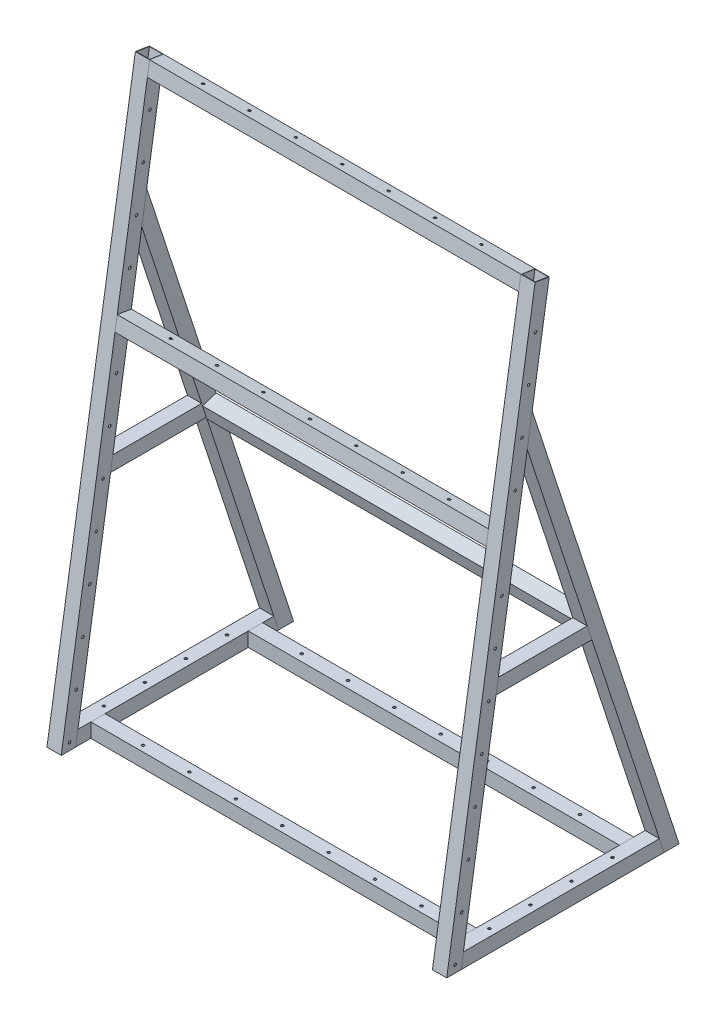
from build123d import *

# Parameters (mm, degrees)
STRUCTURAL_START                = -1397
STRUCTURAL_MEMBER1_DEPTH        = 50.8
STRUCTURAL_MEMBER1_2_DEPTH      = 1.651
STRUCTURAL_START_2              = -1347.851
STRUCTURAL_MEMBER1_3_DEPTH      = 1.651
STRUCTURAL_START_3              = 1904.927734954
STRUCTURAL_MEMBER1_4_OUTLINE_W  = 1320.8
STRUCTURAL_MEMBER1_4_OUTLINE_H  = 1.651
STRUCTURAL_MEMBER1_4_DEPTH      = 50.8
STRUCTURAL_MEMBER1_5_OUTLINE_W  = 1320.8
STRUCTURAL_MEMBER1_5_OUTLINE_H  = 47.498
STRUCTURAL_MEMBER1_5_DEPTH      = 1.651
STRUCTURAL_START_4              = 1954.076734954
STRUCTURAL_MEMBER1_6_OUTLINE_W  = 1320.8
STRUCTURAL_MEMBER1_6_OUTLINE_H  = 47.498
STRUCTURAL_MEMBER1_6_DEPTH      = 1.651
STRUCTURAL_MEMBER1_7_DEPTH      = 50.8
STRUCTURAL_MEMBER1_8_DEPTH      = 1.651
STRUCTURAL_MEMBER1_9_DEPTH      = 1.651
STRUCTURAL_START_5              = -25.4
STRUCTURAL_MEMBER1_10_DEPTH     = 50.8
STRUCTURAL_MEMBER1_11_DEPTH     = 1.651
STRUCTURAL_START_6              = 23.749
STRUCTURAL_MEMBER1_12_DEPTH     = 1.651
STRUCTURAL_MEMBER1_13_DEPTH     = 50.8
STRUCTURAL_MEMBER1_14_DEPTH     = 1.651
STRUCTURAL_MEMBER1_15_DEPTH     = 1.651
STRUCTURAL_MEMBER1_16_DEPTH     = 50.8
STRUCTURAL_MEMBER1_17_DEPTH     = 1.651
STRUCTURAL_MEMBER1_18_DEPTH     = 1.651
STRUCTURAL_START_7              = 497.465561526
STRUCTURAL_MEMBER1_19_OUTLINE_W = 1320.8
STRUCTURAL_MEMBER1_19_OUTLINE_H = 1.651
STRUCTURAL_MEMBER1_19_DEPTH     = 50.8
STRUCTURAL_MEMBER1_20_OUTLINE_W = 1320.8
STRUCTURAL_MEMBER1_20_OUTLINE_H = 47.498
STRUCTURAL_MEMBER1_20_DEPTH     = 1.651
STRUCTURAL_START_8              = 546.614561526
STRUCTURAL_MEMBER1_21_OUTLINE_W = 1320.8
STRUCTURAL_MEMBER1_21_OUTLINE_H = 47.498
STRUCTURAL_MEMBER1_21_DEPTH     = 1.651
STRUCTURAL_MEMBER1_22_DEPTH     = 50.8
STRUCTURAL_MEMBER1_23_DEPTH     = 1.651
STRUCTURAL_MEMBER1_24_DEPTH     = 1.651
STRUCTURAL_MEMBER1_25_DEPTH     = 50.8
STRUCTURAL_MEMBER1_26_DEPTH     = 1.651
STRUCTURAL_MEMBER1_27_DEPTH     = 1.651
STRUCTURAL_MEMBER1_28_DEPTH     = 50.8
STRUCTURAL_MEMBER1_29_DEPTH     = 1.651
STRUCTURAL_MEMBER1_30_DEPTH     = 1.651
STRUCTURAL_START_9              = 1168.327734954
STRUCTURAL_MEMBER1_31_OUTLINE_W = 1320.8
STRUCTURAL_MEMBER1_31_OUTLINE_H = 1.651
STRUCTURAL_MEMBER1_31_DEPTH     = 50.8
STRUCTURAL_MEMBER1_32_OUTLINE_W = 1320.8
STRUCTURAL_MEMBER1_32_OUTLINE_H = 47.498
STRUCTURAL_MEMBER1_32_DEPTH     = 1.651
STRUCTURAL_START_10             = 1217.476734954
STRUCTURAL_MEMBER1_33_OUTLINE_W = 1320.8
STRUCTURAL_MEMBER1_33_OUTLINE_H = 47.498
STRUCTURAL_MEMBER1_33_DEPTH     = 1.651
STRUCTURAL_START_11             = -773.986645849
STRUCTURAL_MEMBER1_34_OUTLINE_W = 1320.8
STRUCTURAL_MEMBER1_34_OUTLINE_H = 1.651
STRUCTURAL_MEMBER1_34_DEPTH     = 50.8
STRUCTURAL_MEMBER1_35_OUTLINE_W = 1320.8
STRUCTURAL_MEMBER1_35_OUTLINE_H = 47.498
STRUCTURAL_MEMBER1_35_DEPTH     = 1.651
STRUCTURAL_START_12             = -724.837645849
STRUCTURAL_MEMBER1_36_OUTLINE_W = 1320.8
STRUCTURAL_MEMBER1_36_OUTLINE_H = 47.498
STRUCTURAL_MEMBER1_36_DEPTH     = 1.651
STRUCTURAL_START_13             = -213.662645849
STRUCTURAL_MEMBER1_37_OUTLINE_W = 1320.8
STRUCTURAL_MEMBER1_37_OUTLINE_H = 1.651
STRUCTURAL_MEMBER1_37_DEPTH     = 50.8
STRUCTURAL_MEMBER1_38_OUTLINE_W = 1320.8
STRUCTURAL_MEMBER1_38_OUTLINE_H = 47.498
STRUCTURAL_MEMBER1_38_DEPTH     = 1.651
STRUCTURAL_START_14             = -164.513645849
STRUCTURAL_MEMBER1_39_OUTLINE_W = 1320.8
STRUCTURAL_MEMBER1_39_OUTLINE_H = 47.498
STRUCTURAL_MEMBER1_39_DEPTH     = 1.651
SKETCH12_R                      = 4.7625
CUT_EXTRUDE1_DEPTH              = 2546.506811911
SKETCH13_R                      = 4.7625
CUT_EXTRUDE2_DEPTH              = 2549.786831157
SKETCH15_R                      = 4.7625
CUT_EXTRUDE3_DEPTH              = 2505.608071401


# Read off the part's stored shape, not the designer's step: Structural Member1
with BuildPart() as part:
    # Structural Member1 outline → Structural Member1 (new body)
    with BuildSketch(Plane.YZ.offset(STRUCTURAL_START)):
        Polygon((1921.145092162, -372.265324136), (-65.036483637, -57.68506687), (-65.036483637, -59.356646793), (1920.88681886, -373.895997586), align=None)
        Polygon((1913.45649464, -420.809218388), (-65.036483637, -107.446715338), (-65.036483637, -109.11829526), (1913.198221338, -422.439891838), align=None)
    extrude(amount=STRUCTURAL_MEMBER1_DEPTH)

    # Structural Member1 2 outline → Structural Member1 2 (add)
    with BuildSketch(Plane.YZ.offset(STRUCTURAL_START)):
        Polygon((1920.88681886, -373.895997586), (-65.036483637, -59.356646793), (-65.036483637, -107.446715338), (1913.45649464, -420.809218388), align=None)
    extrude(amount=STRUCTURAL_MEMBER1_2_DEPTH)

    # Structural Member1 3 outline → Structural Member1 3 (add)
    with BuildSketch(Plane.YZ.offset(STRUCTURAL_START_2)):
        Polygon((1920.88681886, -373.895997586), (-65.036483637, -59.356646793), (-65.036483637, -107.446715338), (1913.45649464, -420.809218388), align=None)
    extrude(amount=STRUCTURAL_MEMBER1_3_DEPTH)


with BuildPart() as body_2:
    # Structural Member1 4 outline → Structural Member1 4 (new body)
    with BuildSketch(Plane(origin=(0, 0, 0), x_dir=(1, 0, 0), z_dir=(0, 0.9876883405951382, -0.15643446504022804)).offset(STRUCTURAL_START_3)):
        with Locations((-685.8, 67.9743155)):
            Rectangle(STRUCTURAL_MEMBER1_4_OUTLINE_W, STRUCTURAL_MEMBER1_4_OUTLINE_H)
        with Locations((-685.8, 117.1233155)):
            Rectangle(STRUCTURAL_MEMBER1_4_OUTLINE_W, STRUCTURAL_MEMBER1_4_OUTLINE_H)
    extrude(amount=STRUCTURAL_MEMBER1_4_DEPTH)

    # Structural Member1 5 outline → Structural Member1 5 (add)
    with BuildSketch(Plane(origin=(0, 0, 0), x_dir=(1, 0, 0), z_dir=(0, 0.9876883405951382, -0.15643446504022804)).offset(STRUCTURAL_START_3)):
        with Locations((-685.8, 92.5488155)):
            Rectangle(STRUCTURAL_MEMBER1_5_OUTLINE_W, STRUCTURAL_MEMBER1_5_OUTLINE_H)
    extrude(amount=STRUCTURAL_MEMBER1_5_DEPTH)

    # Structural Member1 6 outline → Structural Member1 6 (add)
    with BuildSketch(Plane(origin=(0, 0, 0), x_dir=(1, 0, 0), z_dir=(0, 0.9876883405951382, -0.15643446504022804)).offset(STRUCTURAL_START_4)):
        with Locations((-685.8, 92.5488155)):
            Rectangle(STRUCTURAL_MEMBER1_6_OUTLINE_W, STRUCTURAL_MEMBER1_6_OUTLINE_H)
    extrude(amount=STRUCTURAL_MEMBER1_6_DEPTH)


with BuildPart() as body_3:
    # Structural Member1 7 outline → Structural Member1 7 (new body)
    with BuildSketch(Plane.YZ.offset(STRUCTURAL_START)):
        Polygon((-65.036483637, -831.017408501), (-63.385483637, -830.476542849), (-63.385483637, -109.379787971), (-65.036483637, -109.11829526), align=None)
        Polygon((-15.887483637, -116.902732118), (-15.887483637, -814.916254094), (-14.236483637, -814.375388442), (-14.236483637, -117.164224829), align=None)
    extrude(amount=STRUCTURAL_MEMBER1_7_DEPTH)

    # Structural Member1 8 outline → Structural Member1 8 (add)
    with BuildSketch(Plane.YZ.offset(STRUCTURAL_START)):
        Polygon((-63.385483637, -109.379787971), (-63.385483637, -830.476542849), (-15.887483637, -814.916254094), (-15.887483637, -116.902732118), align=None)
    extrude(amount=STRUCTURAL_MEMBER1_8_DEPTH)

    # Structural Member1 9 outline → Structural Member1 9 (add)
    with BuildSketch(Plane.YZ.offset(STRUCTURAL_START_2)):
        Polygon((-63.385483637, -109.379787971), (-63.385483637, -830.476542849), (-15.887483637, -814.916254094), (-15.887483637, -116.902732118), align=None)
    extrude(amount=STRUCTURAL_MEMBER1_9_DEPTH)


with BuildPart() as body_4:
    # Structural Member1 10 outline → Structural Member1 10 (new body)
    with BuildSketch(Plane.YZ.offset(STRUCTURAL_START_5)):
        Polygon((1921.145092162, -372.265324136), (-65.036483637, -57.68506687), (-65.036483637, -59.356646793), (1920.88681886, -373.895997586), align=None)
        Polygon((1913.45649464, -420.809218388), (-65.036483637, -107.446715338), (-65.036483637, -109.11829526), (1913.198221338, -422.439891838), align=None)
    extrude(amount=STRUCTURAL_MEMBER1_10_DEPTH)

    # Structural Member1 11 outline → Structural Member1 11 (add)
    with BuildSketch(Plane.YZ.offset(STRUCTURAL_START_5)):
        Polygon((1920.88681886, -373.895997586), (-65.036483637, -59.356646793), (-65.036483637, -107.446715338), (1913.45649464, -420.809218388), align=None)
    extrude(amount=STRUCTURAL_MEMBER1_11_DEPTH)

    # Structural Member1 12 outline → Structural Member1 12 (add)
    with BuildSketch(Plane.YZ.offset(STRUCTURAL_START_6)):
        Polygon((1920.88681886, -373.895997586), (-65.036483637, -59.356646793), (-65.036483637, -107.446715338), (1913.45649464, -420.809218388), align=None)
    extrude(amount=STRUCTURAL_MEMBER1_12_DEPTH)


with BuildPart() as body_5:
    # Structural Member1 13 outline → Structural Member1 13 (new body)
    with BuildSketch(Plane.YZ.offset(STRUCTURAL_START_5)):
        Polygon((-65.036483637, -831.017408501), (-63.385483637, -830.476542849), (-63.385483637, -109.379787971), (-65.036483637, -109.11829526), align=None)
        Polygon((-15.887483637, -116.902732118), (-15.887483637, -814.916254094), (-14.236483637, -814.375388442), (-14.236483637, -117.164224829), align=None)
    extrude(amount=STRUCTURAL_MEMBER1_13_DEPTH)

    # Structural Member1 14 outline → Structural Member1 14 (add)
    with BuildSketch(Plane.YZ.offset(STRUCTURAL_START_5)):
        Polygon((-63.385483637, -109.379787971), (-63.385483637, -830.476542849), (-15.887483637, -814.916254094), (-15.887483637, -116.902732118), align=None)
    extrude(amount=STRUCTURAL_MEMBER1_14_DEPTH)

    # Structural Member1 15 outline → Structural Member1 15 (add)
    with BuildSketch(Plane.YZ.offset(STRUCTURAL_START_6)):
        Polygon((-63.385483637, -109.379787971), (-63.385483637, -830.476542849), (-15.887483637, -814.916254094), (-15.887483637, -116.902732118), align=None)
    extrude(amount=STRUCTURAL_MEMBER1_15_DEPTH)


with BuildPart() as body_6:
    # Structural Member1 16 outline → Structural Member1 16 (new body)
    with BuildSketch(Plane.YZ.offset(STRUCTURAL_START_5)):
        Polygon((769.741136711, -241.334081454), (768.090136711, -241.072588743), (768.090136711, -558.08611072), (769.741136711, -557.545245068), align=None)
        Polygon((720.592136711, -573.646399474), (720.592136711, -233.549644597), (718.941136711, -233.288151886), (718.941136711, -574.187265126), align=None)
    extrude(amount=STRUCTURAL_MEMBER1_16_DEPTH)

    # Structural Member1 17 outline → Structural Member1 17 (add)
    with BuildSketch(Plane.YZ.offset(STRUCTURAL_START_5)):
        Polygon((768.090136711, -558.08611072), (768.090136711, -241.072588743), (720.592136711, -233.549644597), (720.592136711, -573.646399474), align=None)
    extrude(amount=STRUCTURAL_MEMBER1_17_DEPTH)

    # Structural Member1 18 outline → Structural Member1 18 (add)
    with BuildSketch(Plane.YZ.offset(STRUCTURAL_START_6)):
        Polygon((768.090136711, -558.08611072), (768.090136711, -241.072588743), (720.592136711, -233.549644597), (720.592136711, -573.646399474), align=None)
    extrude(amount=STRUCTURAL_MEMBER1_18_DEPTH)


with BuildPart() as body_7:
    # Structural Member1 19 outline → Structural Member1 19 (new body)
    with BuildSketch(Plane(origin=(0, 0, 0), x_dir=(1, 0, 0), z_dir=(0, 0.9503054817108173, 0.31131895449903413)).offset(STRUCTURAL_START_7)):
        with Locations((-685.8, 819.447808605)):
            Rectangle(STRUCTURAL_MEMBER1_19_OUTLINE_W, STRUCTURAL_MEMBER1_19_OUTLINE_H)
        with Locations((-685.8, 770.298808605)):
            Rectangle(STRUCTURAL_MEMBER1_19_OUTLINE_W, STRUCTURAL_MEMBER1_19_OUTLINE_H)
    extrude(amount=STRUCTURAL_MEMBER1_19_DEPTH)

    # Structural Member1 20 outline → Structural Member1 20 (add)
    with BuildSketch(Plane(origin=(0, 0, 0), x_dir=(1, 0, 0), z_dir=(0, 0.9503054817108173, 0.31131895449903413)).offset(STRUCTURAL_START_7)):
        with Locations((-685.8, 794.873308605)):
            Rectangle(STRUCTURAL_MEMBER1_20_OUTLINE_W, STRUCTURAL_MEMBER1_20_OUTLINE_H)
    extrude(amount=STRUCTURAL_MEMBER1_20_DEPTH)

    # Structural Member1 21 outline → Structural Member1 21 (add)
    with BuildSketch(Plane(origin=(0, 0, 0), x_dir=(1, 0, 0), z_dir=(0, 0.9503054817108173, 0.31131895449903413)).offset(STRUCTURAL_START_8)):
        with Locations((-685.8, 794.873308605)):
            Rectangle(STRUCTURAL_MEMBER1_21_OUTLINE_W, STRUCTURAL_MEMBER1_21_OUTLINE_H)
    extrude(amount=STRUCTURAL_MEMBER1_21_DEPTH)


with BuildPart() as body_8:
    # Structural Member1 22 outline → Structural Member1 22 (new body)
    with BuildSketch(Plane.YZ.offset(STRUCTURAL_START)):
        Polygon((769.741136711, -241.334081454), (768.090136711, -241.072588743), (768.090136711, -558.08611072), (769.741136711, -557.545245068), align=None)
        Polygon((720.592136711, -573.646399474), (720.592136711, -233.549644597), (718.941136711, -233.288151886), (718.941136711, -574.187265126), align=None)
    extrude(amount=STRUCTURAL_MEMBER1_22_DEPTH)

    # Structural Member1 23 outline → Structural Member1 23 (add)
    with BuildSketch(Plane.YZ.offset(STRUCTURAL_START)):
        Polygon((768.090136711, -558.08611072), (768.090136711, -241.072588743), (720.592136711, -233.549644597), (720.592136711, -573.646399474), align=None)
    extrude(amount=STRUCTURAL_MEMBER1_23_DEPTH)

    # Structural Member1 24 outline → Structural Member1 24 (add)
    with BuildSketch(Plane.YZ.offset(STRUCTURAL_START_2)):
        Polygon((768.090136711, -558.08611072), (768.090136711, -241.072588743), (720.592136711, -233.549644597), (720.592136711, -573.646399474), align=None)
    extrude(amount=STRUCTURAL_MEMBER1_24_DEPTH)


with BuildPart() as body_9:
    # Structural Member1 25 outline → Structural Member1 25 (new body)
    with BuildSketch(Plane.YZ.offset(STRUCTURAL_START_5)):
        Polygon((1530.400378516, -361.810669745), (1526.825489788, -361.244462995), (-65.036483637, -882.736567177), (-65.036483637, -884.473903257), align=None)
        Polygon((-65.036483637, -832.75474458), (1423.978690994, -344.955130329), (1420.403802266, -344.388923579), (-65.036483637, -831.017408501), align=None)
    extrude(amount=STRUCTURAL_MEMBER1_25_DEPTH)

    # Structural Member1 26 outline → Structural Member1 26 (add)
    with BuildSketch(Plane.YZ.offset(STRUCTURAL_START_5)):
        Polygon((-65.036483637, -882.736567177), (1526.825489788, -361.244462995), (1423.978690994, -344.955130329), (-65.036483637, -832.75474458), align=None)
    extrude(amount=STRUCTURAL_MEMBER1_26_DEPTH)

    # Structural Member1 27 outline → Structural Member1 27 (add)
    with BuildSketch(Plane.YZ.offset(STRUCTURAL_START_6)):
        Polygon((-65.036483637, -882.736567177), (1526.825489788, -361.244462995), (1423.978690994, -344.955130329), (-65.036483637, -832.75474458), align=None)
    extrude(amount=STRUCTURAL_MEMBER1_27_DEPTH)


with BuildPart() as body_10:
    # Structural Member1 28 outline → Structural Member1 28 (new body)
    with BuildSketch(Plane.YZ.offset(STRUCTURAL_START)):
        Polygon((1530.400378516, -361.810669745), (1526.825489788, -361.244462995), (-65.036483637, -882.736567177), (-65.036483637, -884.473903257), align=None)
        Polygon((-65.036483637, -832.75474458), (1423.978690994, -344.955130329), (1420.403802266, -344.388923579), (-65.036483637, -831.017408501), align=None)
    extrude(amount=STRUCTURAL_MEMBER1_28_DEPTH)

    # Structural Member1 29 outline → Structural Member1 29 (add)
    with BuildSketch(Plane.YZ.offset(STRUCTURAL_START)):
        Polygon((-65.036483637, -882.736567177), (1526.825489788, -361.244462995), (1423.978690994, -344.955130329), (-65.036483637, -832.75474458), align=None)
    extrude(amount=STRUCTURAL_MEMBER1_29_DEPTH)

    # Structural Member1 30 outline → Structural Member1 30 (add)
    with BuildSketch(Plane.YZ.offset(STRUCTURAL_START_2)):
        Polygon((-65.036483637, -882.736567177), (1526.825489788, -361.244462995), (1423.978690994, -344.955130329), (-65.036483637, -832.75474458), align=None)
    extrude(amount=STRUCTURAL_MEMBER1_30_DEPTH)


with BuildPart() as body_11:
    # Structural Member1 31 outline → Structural Member1 31 (new body)
    with BuildSketch(Plane(origin=(0, 0, 0), x_dir=(1, 0, 0), z_dir=(0, 0.9876883405951382, -0.15643446504022804)).offset(STRUCTURAL_START_9)):
        with Locations((-685.8, 67.9743155)):
            Rectangle(STRUCTURAL_MEMBER1_31_OUTLINE_W, STRUCTURAL_MEMBER1_31_OUTLINE_H)
        with Locations((-685.8, 117.1233155)):
            Rectangle(STRUCTURAL_MEMBER1_31_OUTLINE_W, STRUCTURAL_MEMBER1_31_OUTLINE_H)
    extrude(amount=STRUCTURAL_MEMBER1_31_DEPTH)

    # Structural Member1 32 outline → Structural Member1 32 (add)
    with BuildSketch(Plane(origin=(0, 0, 0), x_dir=(1, 0, 0), z_dir=(0, 0.9876883405951382, -0.15643446504022804)).offset(STRUCTURAL_START_9)):
        with Locations((-685.8, 92.5488155)):
            Rectangle(STRUCTURAL_MEMBER1_32_OUTLINE_W, STRUCTURAL_MEMBER1_32_OUTLINE_H)
    extrude(amount=STRUCTURAL_MEMBER1_32_DEPTH)

    # Structural Member1 33 outline → Structural Member1 33 (add)
    with BuildSketch(Plane(origin=(0, 0, 0), x_dir=(1, 0, 0), z_dir=(0, 0.9876883405951382, -0.15643446504022804)).offset(STRUCTURAL_START_10)):
        with Locations((-685.8, 92.5488155)):
            Rectangle(STRUCTURAL_MEMBER1_33_OUTLINE_W, STRUCTURAL_MEMBER1_33_OUTLINE_H)
    extrude(amount=STRUCTURAL_MEMBER1_33_DEPTH)


with BuildPart() as body_12:
    # Structural Member1 34 outline → Structural Member1 34 (new body)
    with BuildSketch(Plane.XY.offset(STRUCTURAL_START_11)):
        with Locations((-685.8, -64.210983637)):
            Rectangle(STRUCTURAL_MEMBER1_34_OUTLINE_W, STRUCTURAL_MEMBER1_34_OUTLINE_H)
        with Locations((-685.8, -15.061983637)):
            Rectangle(STRUCTURAL_MEMBER1_34_OUTLINE_W, STRUCTURAL_MEMBER1_34_OUTLINE_H)
    extrude(amount=STRUCTURAL_MEMBER1_34_DEPTH)

    # Structural Member1 35 outline → Structural Member1 35 (add)
    with BuildSketch(Plane.XY.offset(STRUCTURAL_START_11)):
        with Locations((-685.8, -39.636483637)):
            Rectangle(STRUCTURAL_MEMBER1_35_OUTLINE_W, STRUCTURAL_MEMBER1_35_OUTLINE_H)
    extrude(amount=STRUCTURAL_MEMBER1_35_DEPTH)

    # Structural Member1 36 outline → Structural Member1 36 (add)
    with BuildSketch(Plane.XY.offset(STRUCTURAL_START_12)):
        with Locations((-685.8, -39.636483637)):
            Rectangle(STRUCTURAL_MEMBER1_36_OUTLINE_W, STRUCTURAL_MEMBER1_36_OUTLINE_H)
    extrude(amount=STRUCTURAL_MEMBER1_36_DEPTH)


with BuildPart() as body_13:
    # Structural Member1 37 outline → Structural Member1 37 (new body)
    with BuildSketch(Plane.XY.offset(STRUCTURAL_START_13)):
        with Locations((-685.8, -64.210983637)):
            Rectangle(STRUCTURAL_MEMBER1_37_OUTLINE_W, STRUCTURAL_MEMBER1_37_OUTLINE_H)
        with Locations((-685.8, -15.061983637)):
            Rectangle(STRUCTURAL_MEMBER1_37_OUTLINE_W, STRUCTURAL_MEMBER1_37_OUTLINE_H)
    extrude(amount=STRUCTURAL_MEMBER1_37_DEPTH)

    # Structural Member1 38 outline → Structural Member1 38 (add)
    with BuildSketch(Plane.XY.offset(STRUCTURAL_START_13)):
        with Locations((-685.8, -39.636483637)):
            Rectangle(STRUCTURAL_MEMBER1_38_OUTLINE_W, STRUCTURAL_MEMBER1_38_OUTLINE_H)
    extrude(amount=STRUCTURAL_MEMBER1_38_DEPTH)

    # Structural Member1 39 outline → Structural Member1 39 (add)
    with BuildSketch(Plane.XY.offset(STRUCTURAL_START_14)):
        with Locations((-685.8, -39.636483637)):
            Rectangle(STRUCTURAL_MEMBER1_39_OUTLINE_W, STRUCTURAL_MEMBER1_39_OUTLINE_H)
    extrude(amount=STRUCTURAL_MEMBER1_39_DEPTH)


with BuildPart() as cut_extrude1_tool:
    # Sketch12 → Cut-Extrude1 (new, through all)
    with BuildSketch(Plane(origin=(0, -14.236483637, 0), x_dir=(1, 0, 0), z_dir=(0, 1, 0))):
        with Locations(Location((0, 673.087888442, 0), (0, 0, 180))):
            Circle(SKETCH12_R)
        with Locations(Location((0, 527.037888442, 0), (0, 0, 180))):
            Circle(SKETCH12_R)
        with Locations(Location((0, 380.987888442, 0), (0, 0, 180))):
            Circle(SKETCH12_R)
        with Locations(Location((0, 234.937888442, 0), (0, 0, 180))):
            Circle(SKETCH12_R)
        with Locations(Location((-1371.6, 234.937888442, 0), (0, 0, 90))):
            Circle(SKETCH12_R)
        with Locations(Location((-1371.6, 380.987888442, 0), (0, 0, 90))):
            Circle(SKETCH12_R)
        with Locations(Location((-1371.6, 527.037888442, 0), (0, 0, 90))):
            Circle(SKETCH12_R)
        with Locations(Location((-1371.6, 673.087888442, 0), (0, 0, 90))):
            Circle(SKETCH12_R)
        with Locations(Location((-1181.101758284, 747.824686427, 0), (0, 0, 180))):
            Circle(SKETCH12_R)
        with Locations(Location((-1016.001758284, 747.824686427, 0), (0, 0, 180))):
            Circle(SKETCH12_R)
        with Locations(Location((-850.901758284, 747.824686427, 0), (0, 0, 180))):
            Circle(SKETCH12_R)
        with Locations(Location((-685.801758284, 747.824686427, 0), (0, 0, 180))):
            Circle(SKETCH12_R)
        with Locations(Location((-520.701758284, 747.824686427, 0), (0, 0, 180))):
            Circle(SKETCH12_R)
        with Locations(Location((-355.601758284, 747.824686427, 0), (0, 0, 180))):
            Circle(SKETCH12_R)
        with Locations(Location((-190.501758284, 747.824686427, 0), (0, 0, 180))):
            Circle(SKETCH12_R)
        with Locations((-190.501758284, 183.714926843)):
            Circle(SKETCH12_R)
        with Locations((-355.601758284, 183.714926843)):
            Circle(SKETCH12_R)
        with Locations((-520.701758284, 183.714926843)):
            Circle(SKETCH12_R)
        with Locations((-685.801758284, 183.714926843)):
            Circle(SKETCH12_R)
        with Locations((-850.901758284, 183.714926843)):
            Circle(SKETCH12_R)
        with Locations((-1016.001758284, 183.714926843)):
            Circle(SKETCH12_R)
        with Locations((-1181.101758284, 183.714926843)):
            Circle(SKETCH12_R)
    extrude(amount=-CUT_EXTRUDE1_DEPTH)


with BuildPart() as body_3_1:
    add(body_3.part)

    # Cut-Extrude1: cut by cut_extrude1_tool
    add(cut_extrude1_tool.part, mode=Mode.SUBTRACT)


with BuildPart() as body_5_1:
    add(body_5.part)

    # Cut-Extrude1: cut by cut_extrude1_tool
    add(cut_extrude1_tool.part, mode=Mode.SUBTRACT)


with BuildPart() as body_12_1:
    add(body_12.part)

    # Cut-Extrude1: cut by cut_extrude1_tool
    add(cut_extrude1_tool.part, mode=Mode.SUBTRACT)


with BuildPart() as body_13_1:
    add(body_13.part)

    # Cut-Extrude1: cut by cut_extrude1_tool
    add(cut_extrude1_tool.part, mode=Mode.SUBTRACT)


with BuildPart() as cut_extrude2_tool:
    # Sketch13 → Cut-Extrude2 (new, through all)
    with BuildSketch(Plane.ZY.offset(1397)):
        with Locations((-373.511995515, 1766.647953644)):
            Circle(SKETCH13_R)
        with Locations((-349.671383043, 1616.124250537)):
            Circle(SKETCH13_R)
        with Locations((-325.830770571, 1465.60054743)):
            Circle(SKETCH13_R)
        with Locations((-301.990158099, 1315.076844323)):
            Circle(SKETCH13_R)
        with Locations((-254.308933154, 1014.02943811)):
            Circle(SKETCH13_R)
        with Locations((-230.468320682, 863.505735003)):
            Circle(SKETCH13_R)
        with Locations((-206.62770821, 712.982031897)):
            Circle(SKETCH13_R)
        with Locations((-182.787095738, 562.45832879)):
            Circle(SKETCH13_R)
        with Locations((-158.946483266, 411.934625683)):
            Circle(SKETCH13_R)
        with Locations((-135.105870794, 261.410922577)):
            Circle(SKETCH13_R)
        with Locations((-111.265258322, 110.88721947)):
            Circle(SKETCH13_R)
        with Locations((-87.424645849, -39.636483637)):
            Circle(SKETCH13_R)
    extrude(amount=-CUT_EXTRUDE2_DEPTH)


with BuildPart() as part_1:
    add(part.part)

    # Cut-Extrude2: cut by cut_extrude2_tool
    add(cut_extrude2_tool.part, mode=Mode.SUBTRACT)


with BuildPart() as body_4_1:
    add(body_4.part)

    # Cut-Extrude2: cut by cut_extrude2_tool
    add(cut_extrude2_tool.part, mode=Mode.SUBTRACT)


with BuildPart() as cut_extrude3_tool:
    # Sketch15 → Cut-Extrude3 (new, through all)
    with BuildSketch(Plane(origin=(0, 1931.649481193, -305.943221982), x_dir=(1, 0, 0), z_dir=(0, 0.9876883405951382, -0.1564344650402277))):
        with Locations(Location((-1181.1, 92.5488155, 0), (0, 0, 270))):
            Circle(SKETCH15_R)
        with Locations(Location((-1016, 92.5488155, 0), (0, 0, 270))):
            Circle(SKETCH15_R)
        with Locations(Location((-850.9, 92.5488155, 0), (0, 0, 270))):
            Circle(SKETCH15_R)
        with Locations(Location((-685.8, 92.5488155, 0), (0, 0, 270))):
            Circle(SKETCH15_R)
        with Locations(Location((-520.7, 92.5488155, 0), (0, 0, 270))):
            Circle(SKETCH15_R)
        with Locations(Location((-355.6, 92.5488155, 0), (0, 0, 270))):
            Circle(SKETCH15_R)
        with Locations(Location((-190.5, 92.5488155, 0), (0, 0, 270))):
            Circle(SKETCH15_R)
    extrude(amount=-CUT_EXTRUDE3_DEPTH)


with BuildPart() as body_2_1:
    add(body_2.part)

    # Cut-Extrude3: cut by cut_extrude3_tool
    add(cut_extrude3_tool.part, mode=Mode.SUBTRACT)


with BuildPart() as body_11_1:
    add(body_11.part)

    # Cut-Extrude3: cut by cut_extrude3_tool
    add(cut_extrude3_tool.part, mode=Mode.SUBTRACT)


solid = Compound([body_6.part, body_7.part, body_8.part, body_9.part, body_10.part, body_3_1.part, body_5_1.part, body_12_1.part, body_13_1.part, part_1.part, body_4_1.part, body_2_1.part, body_11_1.part])
